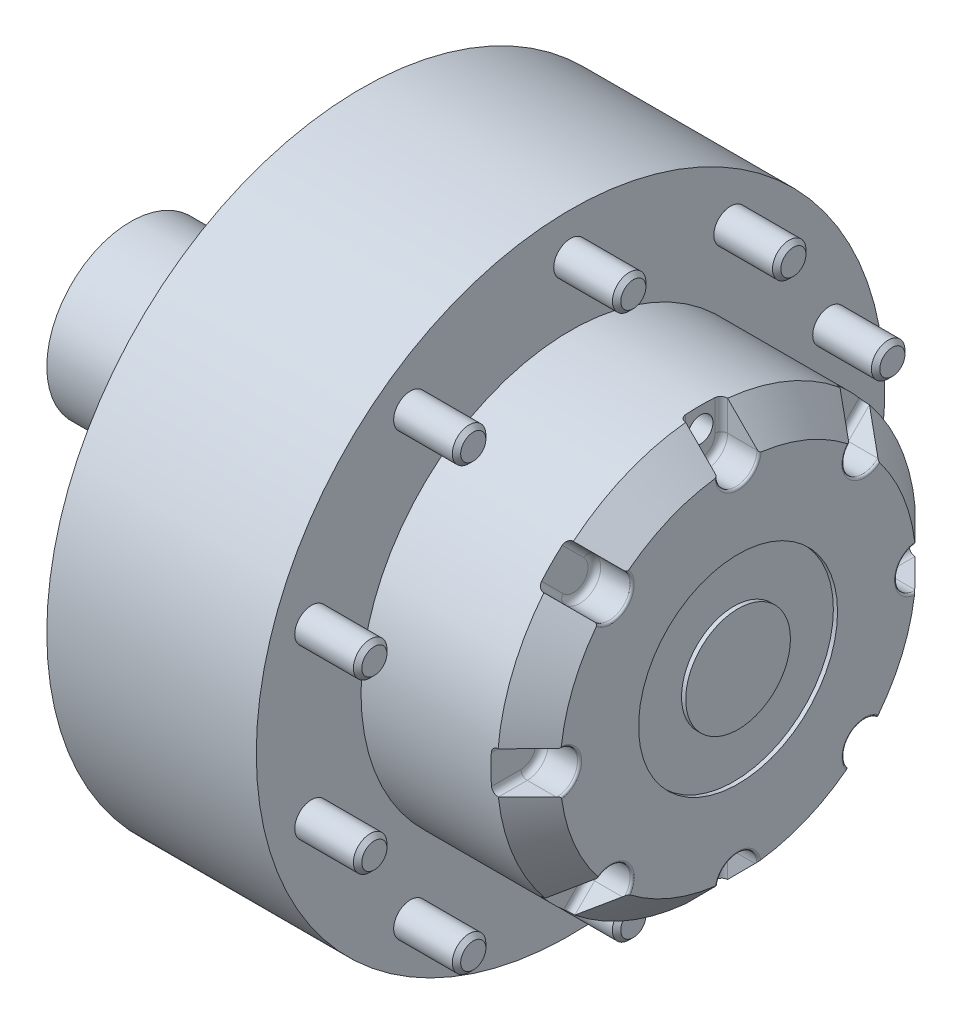
from build123d import *

# Parameters (mm, degrees)
SKETCH2_R                    = 40
BOSS_EXTRUDE1_DEPTH          = 110
CUT_EXTRUDE1_DEPTH           = 18
FILLET1_R                    = 3
FILLET2_R                    = 1
CIRPATTERN1_COUNT            = 8
FILLET1_OF_CIRPATTERN1_R     = 3
FILLET2_OF_CIRPATTERN1_R     = 1
SKETCH4_R                    = 8
BOSS_EXTRUDE2_DEPTH          = 30
CHAMFER1_SIZE                = 2
CIRPATTERN2_COUNT            = 10
CHAMFER1_OF_CIRPATTERN2_SIZE = 2
SKETCH5_R                    = 6
CUT_EXTRUDE2_DEPTH           = 35
SKETCH6_R                    = 47.5
SKETCH6_R_2                  = 25
CUT_EXTRUDE3_DEPTH           = 2


with BuildPart() as part:
    # Sketch1 → Revolve1 (revolve)
    with BuildSketch(Plane.XY, mode=Mode.PRIVATE) as revolve1_sk:
        Polygon((0, 150), (0, 0), (180, 0), (180, 85), (165, 100), (100, 100), (100, 150), align=None)
    revolve(revolve1_sk.sketch.rotate(Axis((0, 0, 0), (1, 0, 0)), 90), axis=Axis((0, 0, 0), (1, 0, 0)))

    # Sketch2 → Boss-Extrude1 (add)
    with BuildSketch(Plane.ZY):
        Circle(SKETCH2_R)
    extrude(amount=BOSS_EXTRUDE1_DEPTH)

    # Sketch3 → Cut-Extrude1 (cut)
    with BuildSketch(Plane(origin=(180, 0, 0), x_dir=(0, 0, -1), z_dir=(1, 0, 0))):
        with BuildLine():
            Line((-10, 85), (-10, 110))
            Line((-10, 110), (10, 110))
            Line((10, 110), (10, 85))
            ThreePointArc((10, 85), (0, 75), (-10, 85))
        make_face()
    cut_extrude1 = extrude(amount=-CUT_EXTRUDE1_DEPTH, mode=Mode.SUBTRACT)

    # Fillet1
    fillet1_edges = [part.edges().sort_by_distance(p)[0] for p in [
        (162, 92.249372, -10),
        (162, 75, 0),
        (162, 92.249372, 10),
    ]]
    fillet(fillet1_edges, radius=FILLET1_R)

    # Fillet2
    # the kernel refuses this fillet: 1 mm, written as the material it takes off along each edge
    with BuildSketch(Plane(origin=(180, 85, 0), x_dir=(0, 0.19034636074519543, -0.9817169973831869), z_dir=(0, 0.9817169973831869, 0.19034636074519543))) as fillet2_piece_1:
        with BuildLine():
            CenterArc((10 + FILLET2_R, FILLET2_R), FILLET2_R, 180, 90)
            Line((10, FILLET2_R), (10, 0))
            Line((10, 0), (10 + FILLET2_R, 0))
        make_face()
    revolve(axis=Axis((180, 85, 0), (-1, 0, 0)), revolution_arc=201.945996, mode=Mode.SUBTRACT)

    # CirPattern1: Cut-Extrude1 ×8 about axis
    cirpattern1_axis = Axis((0, -0.658529, 0), (1, 0, 0))
    for i in range(1, CIRPATTERN1_COUNT):
        add(cut_extrude1.rotate(cirpattern1_axis, i * 360 / CIRPATTERN1_COUNT), mode=Mode.SUBTRACT)

    # Fillet1 of CirPattern1
    fillet1_of_cirpattern1_edges = [part.edges().sort_by_distance(p)[0] for p in [
        (162, 72.108346, 58.624739),
        (162, 52.84013, 53.498659),
        (162, 57.96621, 72.766875),
        (162, 9.341471, 92.907901),
        (162, -0.658529, 75.658529),
        (162, -10.658529, 92.907901),
        (162, -59.283268, 72.766875),
        (162, -54.157188, 53.498659),
        (162, -73.425403, 58.624739),
        (162, -93.56643, 10),
        (162, -76.317058, 0),
        (162, -93.56643, -10),
        (162, -73.425403, -58.624739),
        (162, -54.157188, -53.498659),
        (162, -59.283268, -72.766875),
        (162, -10.658529, -92.907901),
        (162, -0.658529, -75.658529),
        (162, 9.341471, -92.907901),
        (162, 57.96621, -72.766875),
        (162, 52.84013, -53.498659),
        (162, 72.108346, -58.624739),
    ]]
    fillet(fillet1_of_cirpattern1_edges, radius=FILLET1_OF_CIRPATTERN1_R)

    # Fillet2 of CirPattern1
    # the kernel refuses this fillet: 1 mm, written as the material it takes off along each edge
    with BuildSketch(Plane(origin=(180, 59.911198, 60.569727), x_dir=(0, 0.8209454985695548, -0.5710065572113733), z_dir=(0, 0.5710065572113733, 0.8209454985695548))) as fillet2_of_cirpattern1_piece_1:
        with BuildLine():
            CenterArc((10 + FILLET2_OF_CIRPATTERN1_R, FILLET2_OF_CIRPATTERN1_R), FILLET2_OF_CIRPATTERN1_R, 180, 90)
            Line((10, FILLET2_OF_CIRPATTERN1_R), (10, 0))
            Line((10, 0), (10 + FILLET2_OF_CIRPATTERN1_R, 0))
        make_face()
    revolve(axis=Axis((180, 59.911198, 60.569727), (-1, 0, 0)), revolution_arc=199.732776, mode=Mode.SUBTRACT)
    with BuildSketch(Plane(origin=(180, -0.658529, 85.658529), x_dir=(0, 0.991103936902255, 0.13309014334972744), z_dir=(0, -0.13309014334972744, 0.991103936902255))) as fillet2_of_cirpattern1_piece_2:
        with BuildLine():
            CenterArc((10 + FILLET2_OF_CIRPATTERN1_R, FILLET2_OF_CIRPATTERN1_R), FILLET2_OF_CIRPATTERN1_R, 180, 90)
            Line((10, FILLET2_OF_CIRPATTERN1_R), (10, 0))
            Line((10, 0), (10 + FILLET2_OF_CIRPATTERN1_R, 0))
        make_face()
    revolve(axis=Axis((180, -0.658529, 85.658529), (-1, 0, 0)), revolution_arc=194.415449, mode=Mode.SUBTRACT)
    with BuildSketch(Plane(origin=(180, -61.228256, 60.569727), x_dir=(0, 0.6444953813661204, 0.7646082025441128), z_dir=(0, -0.7646082025441128, 0.6444953813661204))) as fillet2_of_cirpattern1_piece_3:
        with BuildLine():
            CenterArc((10 + FILLET2_OF_CIRPATTERN1_R, FILLET2_OF_CIRPATTERN1_R), FILLET2_OF_CIRPATTERN1_R, 180, 90)
            Line((10, FILLET2_OF_CIRPATTERN1_R), (10, 0))
            Line((10, 0), (10 + FILLET2_OF_CIRPATTERN1_R, 0))
        make_face()
    revolve(axis=Axis((180, -61.228256, 60.569727), (-1, 0, 0)), revolution_arc=189.124737, mode=Mode.SUBTRACT)
    with BuildSketch(Plane(origin=(180, -86.317058, 0), x_dir=(0, -0.0605098846650165, 0.9981675980805159), z_dir=(0, -0.9981675980805159, -0.0605098846650165))) as fillet2_of_cirpattern1_piece_4:
        with BuildLine():
            CenterArc((10 + FILLET2_OF_CIRPATTERN1_R, FILLET2_OF_CIRPATTERN1_R), FILLET2_OF_CIRPATTERN1_R, 180, 90)
            Line((10, FILLET2_OF_CIRPATTERN1_R), (10, 0))
            Line((10, 0), (10 + FILLET2_OF_CIRPATTERN1_R, 0))
        make_face()
    revolve(axis=Axis((180, -86.317058, 0), (-1, 0, 0)), revolution_arc=186.93816, mode=Mode.SUBTRACT)
    with BuildSketch(Plane(origin=(180, -61.228256, -60.569727), x_dir=(0, -0.7575944776285203, 0.6527255223038008), z_dir=(0, -0.6527255223038008, -0.7575944776285203))) as fillet2_of_cirpattern1_piece_5:
        with BuildLine():
            CenterArc((10 + FILLET2_OF_CIRPATTERN1_R, FILLET2_OF_CIRPATTERN1_R), FILLET2_OF_CIRPATTERN1_R, 180, 90)
            Line((10, FILLET2_OF_CIRPATTERN1_R), (10, 0))
            Line((10, 0), (10 + FILLET2_OF_CIRPATTERN1_R, 0))
        make_face()
    revolve(axis=Axis((180, -61.228256, -60.569727), (-1, 0, 0)), revolution_arc=189.124737, mode=Mode.SUBTRACT)
    with BuildSketch(Plane(origin=(180, -0.658529, -85.658529), x_dir=(0, -0.9930330198749676, -0.11783641813124746), z_dir=(0, 0.11783641813124746, -0.9930330198749676))) as fillet2_of_cirpattern1_piece_6:
        with BuildLine():
            CenterArc((10 + FILLET2_OF_CIRPATTERN1_R, FILLET2_OF_CIRPATTERN1_R), FILLET2_OF_CIRPATTERN1_R, 180, 90)
            Line((10, FILLET2_OF_CIRPATTERN1_R), (10, 0))
            Line((10, 0), (10 + FILLET2_OF_CIRPATTERN1_R, 0))
        make_face()
    revolve(axis=Axis((180, -0.658529, -85.658529), (-1, 0, 0)), revolution_arc=194.415449, mode=Mode.SUBTRACT)
    with BuildSketch(Plane(origin=(180, 59.911198, -60.569727), x_dir=(0, -0.5799464789162777, -0.8146545780836264), z_dir=(0, 0.8146545780836264, -0.5799464789162777))) as fillet2_of_cirpattern1_piece_7:
        with BuildLine():
            CenterArc((10 + FILLET2_OF_CIRPATTERN1_R, FILLET2_OF_CIRPATTERN1_R), FILLET2_OF_CIRPATTERN1_R, 180, 90)
            Line((10, FILLET2_OF_CIRPATTERN1_R), (10, 0))
            Line((10, 0), (10 + FILLET2_OF_CIRPATTERN1_R, 0))
        make_face()
    revolve(axis=Axis((180, 59.911198, -60.569727), (-1, 0, 0)), revolution_arc=199.732776, mode=Mode.SUBTRACT)

    # Sketch4 → Boss-Extrude2 (add)
    with BuildSketch(Plane(origin=(100, 0, 0), x_dir=(0, 0, -1), z_dir=(1, 0, 0))):
        with Locations(Location((0, 130, 0), (0, 0, 180))):
            Circle(SKETCH4_R)
    boss_extrude2 = extrude(amount=BOSS_EXTRUDE2_DEPTH)

    # Chamfer1
    chamfer1_edges = [part.edges().sort_by_distance(p)[0] for p in [
        (130, 130, -8),
    ]]
    chamfer(chamfer1_edges, length=CHAMFER1_SIZE)

    # CirPattern2: Boss-Extrude2 ×10 about axis
    cirpattern2_axis = Axis((0, 0, 0), (1, 0, 0))
    for i in range(1, CIRPATTERN2_COUNT):
        add(boss_extrude2.rotate(cirpattern2_axis, i * 360 / CIRPATTERN2_COUNT))

    # Chamfer1 of CirPattern2
    chamfer1_of_cirpattern2_edges = [part.edges().sort_by_distance(p)[0] for p in [
        (130, 109.874491, 69.939947),
        (130, 47.780661, 121.165211),
        (130, -32.563757, 126.109483),
        (130, -100.469927, 82.884219),
        (130, -130, 8),
        (130, -109.874491, -69.939947),
        (130, -47.780661, -121.165211),
        (130, 32.563757, -126.109483),
        (130, 100.469927, -82.884219),
    ]]
    chamfer(chamfer1_of_cirpattern2_edges, length=CHAMFER1_OF_CIRPATTERN2_SIZE)

    # Sketch5 → Cut-Extrude2 (cut)
    with BuildSketch(Plane(origin=(180, 0, 0), x_dir=(0, 0, -1), z_dir=(1, 0, 0))):
        with Locations((0, 90)):
            Circle(SKETCH5_R)
    extrude(amount=-CUT_EXTRUDE2_DEPTH, mode=Mode.SUBTRACT)

    # Sketch6 → Cut-Extrude3 (cut)
    with BuildSketch(Plane(origin=(180, 0, 0), x_dir=(0, 0, -1), z_dir=(1, 0, 0))):
        Circle(SKETCH6_R)
        Circle(SKETCH6_R_2, mode=Mode.SUBTRACT)
    extrude(amount=-CUT_EXTRUDE3_DEPTH, mode=Mode.SUBTRACT)


solid = part.part
